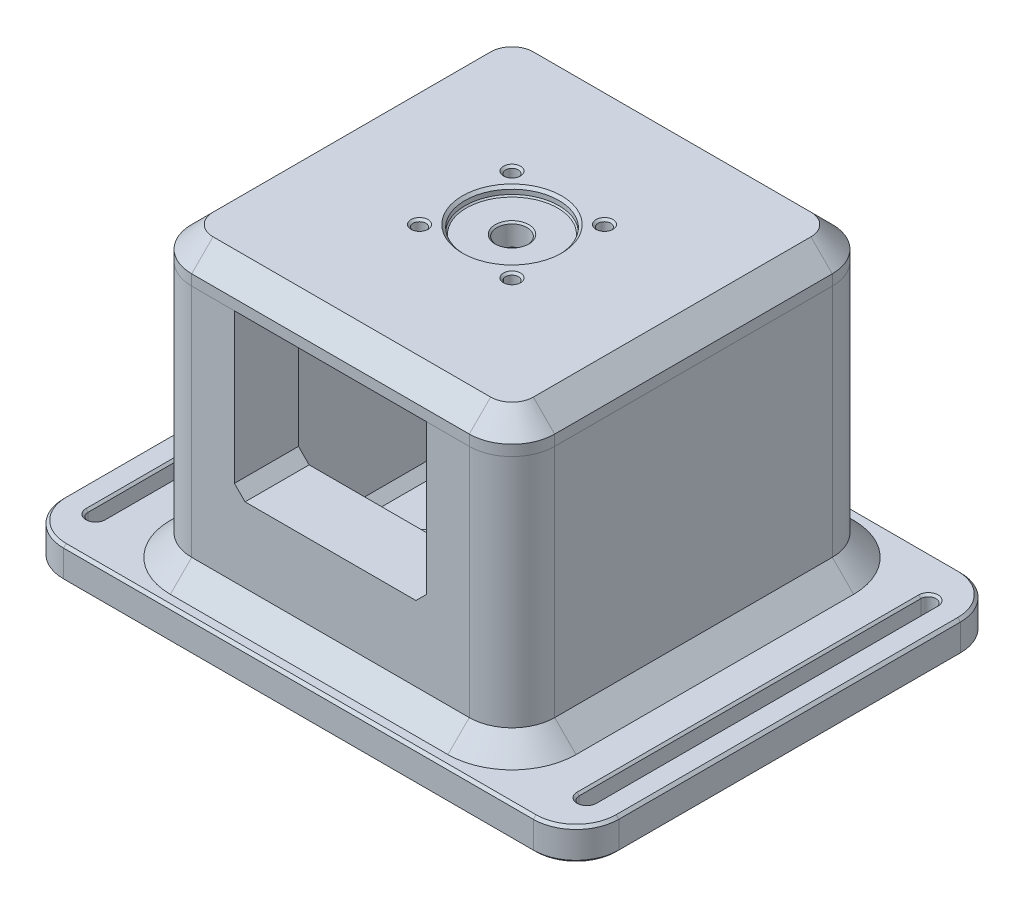
from build123d import *

# Parameters (mm, degrees)
SKETCH1_W                   = 165.1
SKETCH1_H                   = 127
BOSS_EXTRUDE1_DEPTH         = 9.525
SKETCH2_W                   = 57.15
SKETCH2_H                   = 19.05
BOSS_EXTRUDE2_DEPTH         = 38.1
BOSS_EXTRUDE3_DEPTH         = 85.725
BOSS_EXTRUDE4_START         = 85.725
SKETCH2_4_W                 = 57.15
SKETCH2_4_H                 = 19.05
SKETCH2_4_W_2               = 69.85
SKETCH2_4_H_2               = 69.85
BOSS_EXTRUDE4_DEPTH         = 9.525
CUT_EXTRUDE1_DEPTH          = 142.135803395
CUT_EXTRUDE1_DEPTH_BACK     = 2.54
SKETCH7_R                   = 13.97
F_8_START                   = -50.8
F_8_CLEARANCE_SLOT1_2_DEPTH = 101.6
CIRPATTERN1_COUNT           = 4
F_1_4_START                 = 25.4
F_1_4_CLEARANCE_SLOT1_DEPTH = 12.7
FILLET2_R                   = 3.175
FILLET1_R                   = 12.7
CHAMFER1_SIZE               = 2.54
CHAMFER8_SIZE               = 6.35
CHAMFER2_SIZE               = 6.35
CHAMFER9_SIZE               = 3.175
CHAMFER3_SIZE               = 0.79375
CHAMFER5_SIZE               = 0.79375
CHAMFER6_SIZE               = 0.396875


with BuildPart() as part:
    # Sketch1 → Boss-Extrude1 (new body)
    with BuildSketch(Plane(origin=(0, 0, 0), x_dir=(1, 0, 0), z_dir=(0, 1, 0))):
        Rectangle(SKETCH1_W, SKETCH1_H)
    extrude(amount=BOSS_EXTRUDE1_DEPTH)

    # Sketch2 → Boss-Extrude2 (add)
    with BuildSketch(Plane(origin=(0, 0, 0), x_dir=(1, 0, 0), z_dir=(0, 1, 0))):
        Polygon((-28.575, 53.975), (-53.975, 53.975), (-53.975, -53.975), (-28.575, -53.975), (-28.575, -34.925), (-34.925, -34.925), (-34.925, 34.925), (-28.575, 34.925), align=None)
        with Locations((0, 44.45)):
            Rectangle(SKETCH2_W, SKETCH2_H)
        Polygon((53.975, 53.975), (28.575, 53.975), (28.575, 34.925), (34.925, 34.925), (34.925, -34.925), (28.575, -34.925), (28.575, -53.975), (53.975, -53.975), align=None)
        with Locations((0, -44.45)):
            Rectangle(SKETCH2_W, SKETCH2_H)
    extrude(amount=BOSS_EXTRUDE2_DEPTH)

    # Sketch2<3> → Boss-Extrude3 (add)
    with BuildSketch(Plane(origin=(0, 0, 0), x_dir=(1, 0, 0), z_dir=(0, 1, 0))):
        Polygon((-28.575, 53.975), (-53.975, 53.975), (-53.975, -53.975), (-28.575, -53.975), (-28.575, -34.925), (-34.925, -34.925), (-34.925, 34.925), (-28.575, 34.925), align=None)
        Polygon((53.975, 53.975), (28.575, 53.975), (28.575, 34.925), (34.925, 34.925), (34.925, -34.925), (28.575, -34.925), (28.575, -53.975), (53.975, -53.975), align=None)
    extrude(amount=BOSS_EXTRUDE3_DEPTH)

    # Sketch2<4> → Boss-Extrude4 (add)
    with BuildSketch(Plane(origin=(0, 0, 0), x_dir=(1, 0, 0), z_dir=(0, 1, 0)).offset(BOSS_EXTRUDE4_START)):
        with Locations((0, 44.45)):
            Rectangle(SKETCH2_4_W, SKETCH2_4_H)
        Polygon((-28.575, 53.975), (-53.975, 53.975), (-53.975, -53.975), (-28.575, -53.975), (-28.575, -34.925), (-34.925, -34.925), (-34.925, 34.925), (-28.575, 34.925), align=None)
        with Locations((0, -44.45)):
            Rectangle(SKETCH2_4_W, SKETCH2_4_H)
        Polygon((53.975, 53.975), (28.575, 53.975), (28.575, 34.925), (34.925, 34.925), (34.925, -34.925), (28.575, -34.925), (28.575, -53.975), (53.975, -53.975), align=None)
        Rectangle(SKETCH2_4_W_2, SKETCH2_4_H_2)
    extrude(amount=BOSS_EXTRUDE4_DEPTH)

    # Sketch7 → Cut-Extrude1 (cut, two sides: drawn at the far end of the back side and taken through both)
    with BuildSketch(Plane(origin=(0, 95.25, 0), x_dir=(1, 0, 0), z_dir=(0, 1, 0)).offset(-CUT_EXTRUDE1_DEPTH_BACK)):
        with Locations(Location((0, 0, 0), (0, 0, 90))):
            Circle(SKETCH7_R)
    extrude(amount=CUT_EXTRUDE1_DEPTH + CUT_EXTRUDE1_DEPTH_BACK, mode=Mode.SUBTRACT)

    # Sketch19 → M8 Clearance Hole1 (revolve, cut)
    with BuildSketch(Plane(origin=(0, 92.71, 0), x_dir=(0, 0, 1), z_dir=(1, 0, 0))):
        Polygon((0, 0), (0, 6.985), (5, 6.985), (4.5, 6.485), (4.5, 0.5), (5, 0), align=None)
    revolve(axis=Axis((0, 99.06, 0), (0, -1, 0)), mode=Mode.SUBTRACT)

    # #8 Clearance Slot1: read off the stored shape, not the designer's step
    # #8 Clearance Slot1 outline → #8 Clearance Slot1 (revolve, cut)
    with BuildSketch(Plane(origin=(73.025, 0, -50.8), x_dir=(1, 0, 0), z_dir=(0, 0, 1))):
        Polygon((0, 0), (2.8829, 0), (2.2479, 0.635), (2.2479, 8.89), (2.8829, 9.525), (0, 9.525), align=None)
    revolve(axis=Axis((73.025, 0, -50.8), (0, 1, 0)), mode=Mode.SUBTRACT)

    # 8 Clearance Slot1 2 outline → 8 Clearance Slot1 2 (cut)
    with BuildSketch(Plane.XY.offset(F_8_START)):
        Polygon((75.9079, 9.525), (70.1421, 9.525), (70.7771, 8.89), (70.7771, 0.635), (70.1421, 0), (75.9079, 0), (75.2729, 0.635), (75.2729, 8.89), align=None)
        Polygon((-70.7771, 8.89), (-70.1421, 9.525), (-75.9079, 9.525), (-75.2729, 8.89), (-75.2729, 0.635), (-75.9079, 0), (-70.1421, 0), (-70.7771, 0.635), align=None)
    extrude(amount=F_8_CLEARANCE_SLOT1_2_DEPTH, mode=Mode.SUBTRACT)

    # 8 Clearance Slot1 3 outline → 8 Clearance Slot1 3 (revolve, cut)
    with BuildSketch(Plane(origin=(73.025, 0, 50.8), x_dir=(1, 0, 0), z_dir=(0, 0, 1))):
        Polygon((0, 0), (2.8829, 0), (2.2479, 0.635), (2.2479, 8.89), (2.8829, 9.525), (0, 9.525), align=None)
    revolve(axis=Axis((73.025, 0, 50.8), (0, 1, 0)), mode=Mode.SUBTRACT)

    # 8 Clearance Slot1 4 outline → 8 Clearance Slot1 4 (revolve, cut)
    with BuildSketch(Plane(origin=(-73.025, 0, -50.8), x_dir=(1, 0, 0), z_dir=(0, 0, 1))):
        Polygon((0, 0), (2.8829, 0), (2.2479, 0.635), (2.2479, 8.89), (2.8829, 9.525), (0, 9.525), align=None)
    revolve(axis=Axis((-73.025, 0, -50.8), (0, 1, 0)), mode=Mode.SUBTRACT)

    # 8 Clearance Slot1 5 outline → 8 Clearance Slot1 5 (revolve, cut)
    with BuildSketch(Plane(origin=(-73.025, 0, 50.8), x_dir=(1, 0, 0), z_dir=(0, 0, 1))):
        Polygon((0, 0), (2.8829, 0), (2.2479, 0.635), (2.2479, 8.89), (2.8829, 9.525), (0, 9.525), align=None)
    revolve(axis=Axis((-73.025, 0, 50.8), (0, 1, 0)), mode=Mode.SUBTRACT)

    # Sketch11 → 3/4 (0.75) Diameter Hole1 (revolve, cut)
    with BuildSketch(Plane(origin=(13.748772121, 0, 13.748772121), x_dir=(0, 0, -1), z_dir=(1, 0, 0))):
        Polygon((0, 0), (0, 9.525), (10.16, 9.525), (9.525, 8.89), (9.525, 0.635), (10.16, 0), align=None)
    f_3_4_0_75_diameter_hole1 = revolve(axis=Axis((13.748772121, -6.35, 13.748772121), (0, 1, 0)), mode=Mode.SUBTRACT)

    # Sketch13 → CBORE for #6 Binding Head Machine Screw1 (revolve, cut)
    with BuildSketch(Plane(origin=(13.748772121, 85.725, 13.748772121), x_dir=(0, 0, -1), z_dir=(1, 0, 0))):
        Polygon((0, 0), (0, 9.525), (2.53365, 9.525), (1.89865, 8.89), (1.89865, 4.4323), (2.53365, 3.7973), (4.18465, 3.7973), (4.18465, 0.635), (4.81965, 0), align=None)
    cbore_for_6_binding_head_machine_screw1 = revolve(axis=Axis((13.748772121, 79.375, 13.748772121), (0, 1, 0)), mode=Mode.SUBTRACT)

    # CirPattern1: 3/4 (0.75) Diameter Hole1, CBORE for #6 Binding Head Machine Screw1 ×4 about axis
    cirpattern1_axis = Axis((0, 0, 0), (0, 1, 0))
    add([f_3_4_0_75_diameter_hole1.rotate(cirpattern1_axis, i * 360 / CIRPATTERN1_COUNT) for i in range(1, CIRPATTERN1_COUNT)], mode=Mode.SUBTRACT)
    add([cbore_for_6_binding_head_machine_screw1.rotate(cirpattern1_axis, i * 360 / CIRPATTERN1_COUNT) for i in range(1, CIRPATTERN1_COUNT)], mode=Mode.SUBTRACT)

    # 1/4 Clearance Slot1: read off the stored shape, not the designer's step
    # 1/4 Clearance Slot1 outline → 1/4 Clearance Slot1 (cut)
    with BuildSketch(Plane(origin=(0, 0, 0), x_dir=(1, 0, 0), z_dir=(0, 1, 0)).offset(F_1_4_START)):
        Polygon((3.3782, 53.5432), (3.81, 53.975), (-3.81, 53.975), (-3.3782, 53.5432), (-3.3782, 35.3568), (-3.81, 34.925), (3.81, 34.925), (3.3782, 35.3568), align=None)
    extrude(amount=F_1_4_CLEARANCE_SLOT1_DEPTH, mode=Mode.SUBTRACT)

    # 1_4 Clearance Slot1 2 outline → 1_4 Clearance Slot1 2 (revolve, cut)
    with BuildSketch(Plane.XZ.offset(-25.4)):
        Polygon((3.81, -34.925), (0, -34.925), (0, -53.975), (3.81, -53.975), (3.3782, -53.5432), (3.3782, -35.3568), align=None)
    revolve(axis=Axis((0, 25.4, 0), (0, 0, 1)), mode=Mode.SUBTRACT)

    # Fillet2
    fillet2_edges = [part.edges().sort_by_distance(p)[0] for p in [
        (-34.925, 47.625, -34.925),
        (34.925, 47.625, -34.925),
        (34.925, 47.625, 34.925),
        (-34.925, 47.625, 34.925),
    ]]
    fillet(fillet2_edges, radius=FILLET2_R)

    # Fillet1
    fillet1_edges = [part.edges().sort_by_distance(p)[0] for p in [
        (53.975, 52.3875, 53.975),
        (53.975, 52.3875, -53.975),
        (-53.975, 52.3875, -53.975),
        (-53.975, 52.3875, 53.975),
        (82.55, 4.7625, 63.5),
        (-82.55, 4.7625, 63.5),
        (-82.55, 4.7625, -63.5),
        (82.55, 4.7625, -63.5),
    ]]
    fillet(fillet1_edges, radius=FILLET1_R)

    # Chamfer1
    chamfer1_edges = [part.edges().sort_by_distance(p)[0] for p in [
        (0, 9.525, -34.925),
        (-34.925, 9.525, 0),
        (0, 9.525, 34.925),
        (34.925, 9.525, 0),
        (33.99506403, 9.525, 33.99506403),
        (-33.99506403, 9.525, 33.99506403),
        (33.99506403, 9.525, -33.99506403),
        (-33.99506403, 9.525, -33.99506403),
    ]]
    chamfer(chamfer1_edges, length=CHAMFER1_SIZE)

    # Chamfer8
    chamfer8_edges = [part.edges().sort_by_distance(p)[0] for p in [
        (53.975, 9.525, 0),
        (0, 9.525, 53.975),
        (-53.975, 9.525, 0),
        (0, 9.525, -53.975),
        (-50.255256121, 9.525, -50.255256121),
        (50.255256121, 9.525, -50.255256121),
        (50.255256121, 9.525, 50.255256121),
        (-50.255256121, 9.525, 50.255256121),
    ]]
    chamfer(chamfer8_edges, length=CHAMFER8_SIZE)

    # Chamfer2
    chamfer2_edges = [part.edges().sort_by_distance(p)[0] for p in [
        (-53.975, 95.25, 0),
        (0, 95.25, -53.975),
        (0, 95.25, 53.975),
        (53.975, 95.25, 0),
        (-50.255256121, 95.25, 50.255256121),
        (50.255256121, 95.25, 50.255256121),
        (50.255256121, 95.25, -50.255256121),
        (-50.255256121, 95.25, -50.255256121),
    ]]
    chamfer(chamfer2_edges, length=CHAMFER2_SIZE)

    # Chamfer9
    chamfer9_edges = [part.edges().sort_by_distance(p)[0] for p in [
        (28.575, 38.1, -44.45),
        (28.575, 38.1, 44.45),
        (-3.3782, 38.1, -44.45),
        (3.3782, 38.1, -44.45),
        (-28.575, 38.1, 44.45),
        (-28.575, 38.1, -44.45),
    ]]
    chamfer(chamfer9_edges, length=CHAMFER9_SIZE)

    # Chamfer3
    chamfer3_edges = [part.edges().sort_by_distance(p)[0] for p in [
        (0, 0, -63.5),
        (0, 9.525, -63.5),
        (82.55, 0, 0),
        (0, 0, 63.5),
        (-82.55, 0, 0),
        (78.830256121, 0, 59.780256121),
        (-78.830256121, 0, 59.780256121),
        (-78.830256121, 0, -59.780256121),
        (78.830256121, 0, -59.780256121),
        (82.55, 9.525, 0),
        (-82.55, 9.525, 0),
        (0, 9.525, 63.5),
        (78.830256121, 9.525, 59.780256121),
        (-78.830256121, 9.525, 59.780256121),
        (-78.830256121, 9.525, -59.780256121),
        (78.830256121, 9.525, -59.780256121),
    ]]
    chamfer(chamfer3_edges, length=CHAMFER3_SIZE)

    # Chamfer5
    chamfer5_edges = [part.edges().sort_by_distance(p)[0] for p in [
        (0, 95.25, 13.97),
    ]]
    chamfer(chamfer5_edges, length=CHAMFER5_SIZE)

    # Chamfer6
    chamfer6_edges = [part.edges().sort_by_distance(p)[0] for p in [
        (0, 92.71, 13.97),
    ]]
    chamfer(chamfer6_edges, length=CHAMFER6_SIZE)


with BuildPart() as body_2:
    # Split1: the piece on the far side of the plane
    add(part.part)
    split(bisect_by=Plane.ZX.offset(85.725), keep=Keep.BOTTOM)


with BuildPart() as part_1:
    add(part.part)

    # Split1
    split(bisect_by=Plane.ZX.offset(85.725), keep=Keep.TOP)


solid = Compound([body_2.part, part_1.part])
